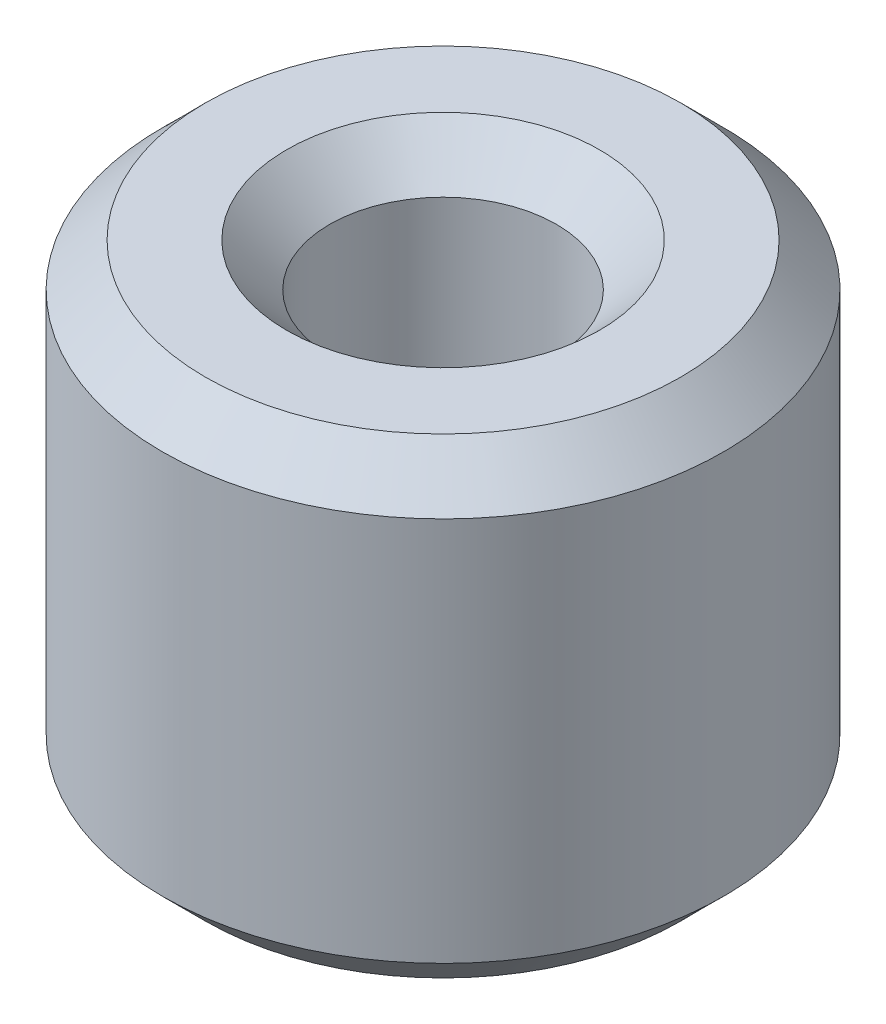
from build123d import *

# Parameters (mm, degrees)
SKETCH1_R           = 22.5
BOSS_EXTRUDE1_DEPTH = 37.762597138
SKETCH2_R           = 9.089155158
CUT_EXTRUDE1_DEPTH  = 50.381309648
CHAMFER1_SIZE       = 3.453403666


with BuildPart() as part:
    # Sketch1 → Boss-Extrude1 (new body)
    with BuildSketch(Plane(origin=(0, 0, 0), x_dir=(1, 0, 0), z_dir=(0, 1, 0))):
        Circle(SKETCH1_R)
    extrude(amount=BOSS_EXTRUDE1_DEPTH)

    # Sketch2 → Cut-Extrude1 (cut, through all)
    with BuildSketch(Plane(origin=(0, 0, 0), x_dir=(1, 0, 0), z_dir=(0, 1, 0))):
        Circle(SKETCH2_R)
    extrude(amount=CUT_EXTRUDE1_DEPTH, mode=Mode.SUBTRACT)

    # Chamfer1
    chamfer1_edges = [part.edges().sort_by_distance(p)[0] for p in [
        (-9.089155158, 37.762597138, 0),
        (-9.089155158, 0, 0),
        (-22.5, 0, 0),
        (-22.5, 37.762597138, 0),
    ]]
    chamfer(chamfer1_edges, length=CHAMFER1_SIZE)


solid = part.part
